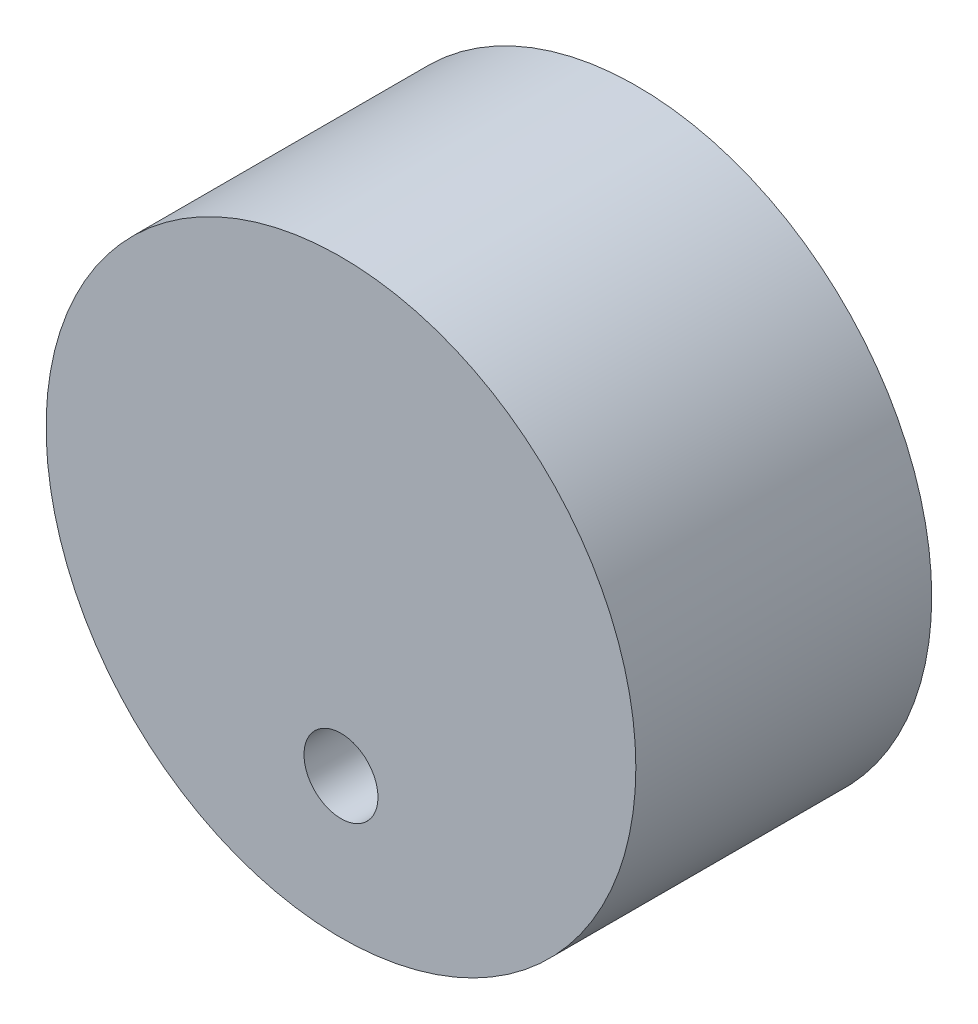
from build123d import *

# Parameters (mm, degrees)
SKETCH1_R           = 25.314646171
BOSS_EXTRUDE1_DEPTH = 25.4
SKETCH2_R           = 3.175
CUT_EXTRUDE1_DEPTH  = 25.4


with BuildPart() as part:
    # Sketch1 → Boss-Extrude1 (new body)
    with BuildSketch(Plane.XY):
        Circle(SKETCH1_R)
    extrude(amount=BOSS_EXTRUDE1_DEPTH)

    # Sketch2 → Cut-Extrude1 (cut)
    with BuildSketch(Plane.XY.offset(25.4)):
        with Locations((0, -13.278788033)):
            Circle(SKETCH2_R)
    extrude(amount=-CUT_EXTRUDE1_DEPTH, mode=Mode.SUBTRACT)


solid = part.part
